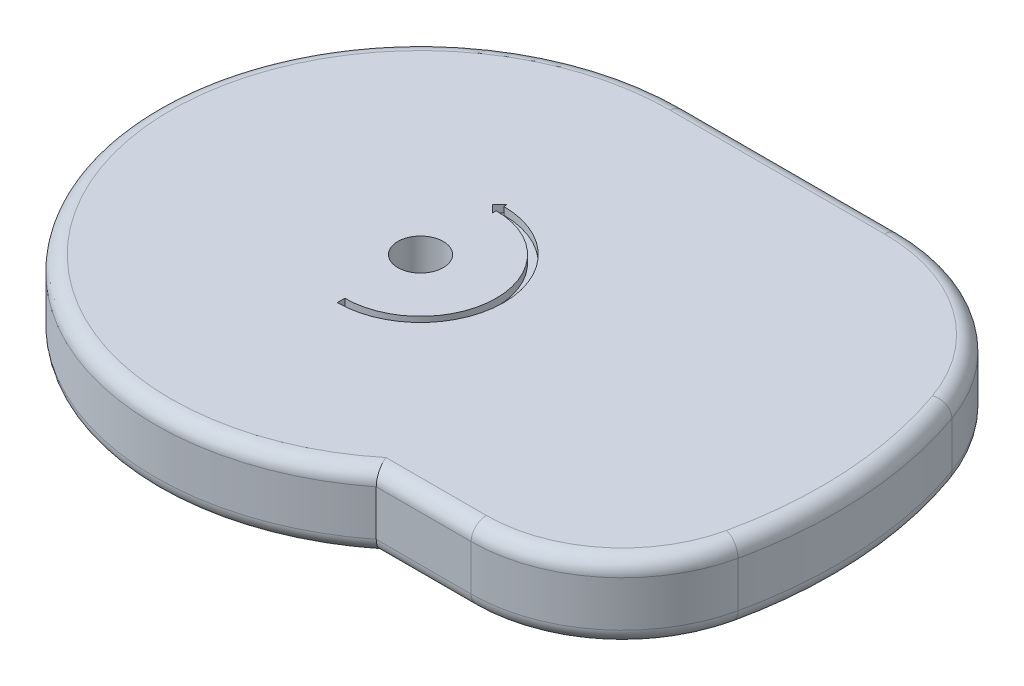
from build123d import *

# Parameters (mm, degrees)
SKETCH_1_R          = 3
EXTRUDE_1_DEPTH     = 10
FILLET_1_R          = 2
CUT_EXTRUDE_1_DEPTH = 1


with BuildPart() as part:
    # 草圖1 → 填料-伸長1 (new body)
    with BuildSketch(Plane(origin=(0, 0, 0), x_dir=(1, 0, 0), z_dir=(0, 1, 0))):
        with BuildLine():
            Line((0, 35), (28.284271247, 35))
            ThreePointArc((28.284271247, 35), (42.718027977, 30.412414523), (51.854497287, 18.333333333))
            ThreePointArc((51.854497287, 18.333333333), (54.894534338, 3.404423566), (53.722406301, -11.785714286))
            ThreePointArc((53.722406301, -11.785714286), (46.722649239, -23.083874449), (34.186985828, -27.5))
            Line((34.186985828, -27.5), (21.650635095, -27.5))
            ThreePointArc((21.650635095, -27.5), (-33.071891388, -11.456439237), (0, 35))
        make_face()
        Circle(SKETCH_1_R, mode=Mode.SUBTRACT)
    extrude(amount=EXTRUDE_1_DEPTH)

    # 圓角1
    fillet_1_edges = [part.edges().sort_by_distance(p)[0] for p in [
        (14.142135624, 0, -35),
        (42.718027977, 0, -30.412414523),
        (54.894534338, 0, -3.404423566),
        (27.918810461, 0, 27.5),
        (46.722649239, 0, 23.083874449),
        (-33.071891388, 0, 11.456439237),
        (54.894534338, 10, -3.404423566),
        (42.718027977, 10, -30.412414523),
        (14.142135624, 10, -35),
        (27.918810461, 10, 27.5),
        (46.722649239, 10, 23.083874449),
        (-33.071891388, 10, 11.456439237),
    ]]
    fillet(fillet_1_edges, radius=FILLET_1_R)

    # 草圖2 → 除料-伸長1 (cut)
    with BuildSketch(Plane(origin=(0, 10, 0), x_dir=(1, 0, 0), z_dir=(0, 1, 0))):
        with BuildLine():
            Line((0, -10), (0, -11))
            ThreePointArc((0, -11), (11, 0), (0, 11))
            Line((0, 11), (0, 11.5))
            Line((0, 11.5), (-1, 10.5))
            Line((-1, 10.5), (0, 9.5))
            Line((0, 9.5), (0, 10))
            ThreePointArc((0, 10), (10, 0), (0, -10))
        make_face()
    extrude(amount=-CUT_EXTRUDE_1_DEPTH, mode=Mode.SUBTRACT)


solid = part.part
